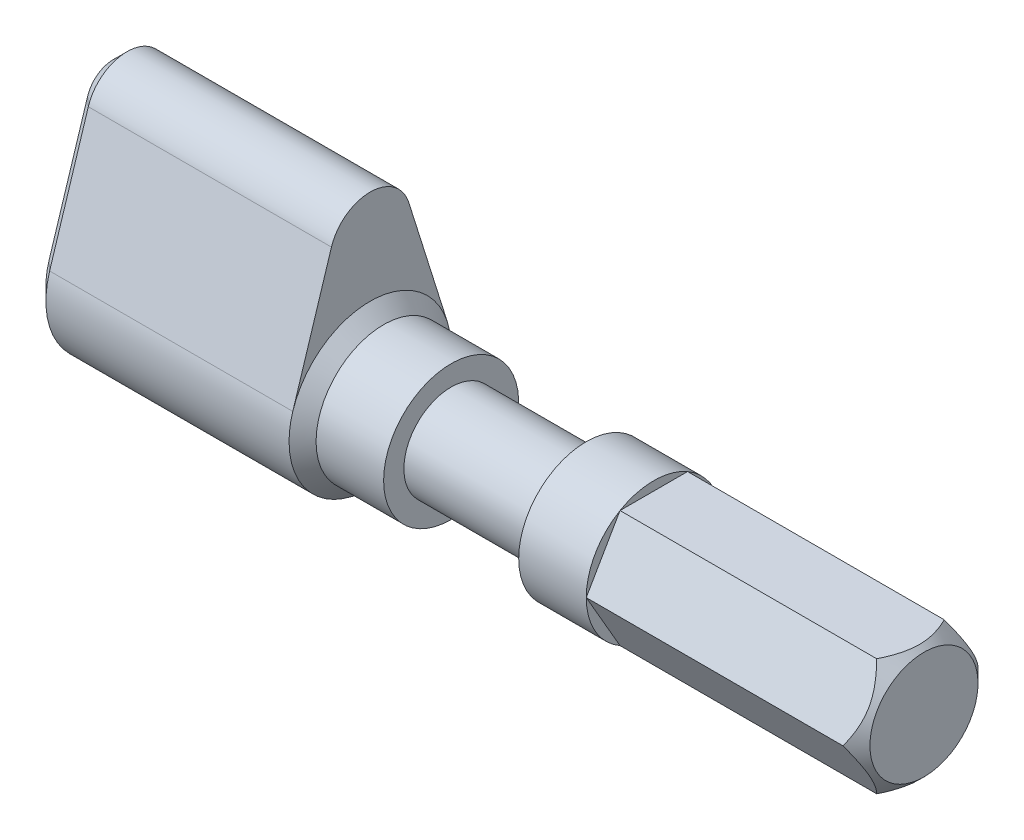
from build123d import *

# Parameters (mm, degrees)
CHAMFER1_SIZE       = 1
BOSS_EXTRUDE1_START = -19
BOSS_EXTRUDE1_DEPTH = 19
CHAMFER2_SIZE       = 1
SKETCH3_OUTSIDE_W   = 26.814
SKETCH3_OUTSIDE_H   = 33.814
CUT_EXTRUDE1_DEPTH  = 20
SKETCH4_W           = 10
SKETCH4_H           = 4.464883459


with BuildPart() as part:
    # Sketch1 → Revolve1 (revolve)
    with BuildSketch(Plane.XY, mode=Mode.PRIVATE) as revolve1_sk:
        Polygon((0, 0), (0, 6), (20, 6), (20, 5), (60, 5), (60, 0), align=None)
    revolve(revolve1_sk.sketch.rotate(Axis((0, 0, 0), (1, 0, 0)), 90), axis=Axis((0, 0, 0), (1, 0, 0)))

    # Chamfer1
    chamfer1_edges = [part.edges().sort_by_distance(p)[0] for p in [
        (60, 0, -5),
        (20, 0, -6),
    ]]
    chamfer(chamfer1_edges, length=CHAMFER1_SIZE - 0.0001)  # a hair under: the kernel refuses the full size

    # Sketch2 → Boss-Extrude1 (add)
    with BuildSketch(Plane.ZY.offset(BOSS_EXTRUDE1_START)):
        with BuildLine():
            ThreePointArc((2.861817604, 10.9), (0, 13), (-2.861817604, 10.9))
            Line((-2.861817604, 10.9), (-5.723635209, 1.8))
            ThreePointArc((-5.723635209, 1.8), (0, 6), (5.723635209, 1.8))
            Line((5.723635209, 1.8), (2.861817604, 10.9))
        make_face()
    extrude(amount=BOSS_EXTRUDE1_DEPTH)

    # Chamfer2
    chamfer2_edges = [part.edges().sort_by_distance(p)[0] for p in [
        (0, -5.930506355, -0.910546196),
        (0, 6.35, 4.292726406),
        (0, 13, 0),
        (0, 6.35, -4.292726406),
    ]]
    chamfer(chamfer2_edges, length=CHAMFER2_SIZE)

    # Sketch3 outside → Cut-Extrude1 (cut)
    with BuildSketch(Plane(origin=(60, 0, 0), x_dir=(0, 0, -1), z_dir=(1, 0, 0))):
        with Locations((0, 3.5)):
            Rectangle(SKETCH3_OUTSIDE_W, SKETCH3_OUTSIDE_H)
        Polygon((5, 0), (2.5, 4.330127019), (-2.5, 4.330127019), (-5, 0), (-2.5, -4.330127019), (2.5, -4.330127019), align=None, mode=Mode.SUBTRACT)
    extrude(amount=-CUT_EXTRUDE1_DEPTH, mode=Mode.SUBTRACT)

    # Sketch4 → Cut-Revolve1 (revolve, cut)
    with BuildSketch(Plane.XY, mode=Mode.PRIVATE) as cut_revolve1_sk:
        with Locations((30, 5.732441729)):
            Rectangle(SKETCH4_W, SKETCH4_H)
    revolve(cut_revolve1_sk.sketch.rotate(Axis((40, 0, 0), (-1, 0, 0)), 270), axis=Axis((40, 0, 0), (-1, 0, 0)), mode=Mode.SUBTRACT)


solid = part.part
